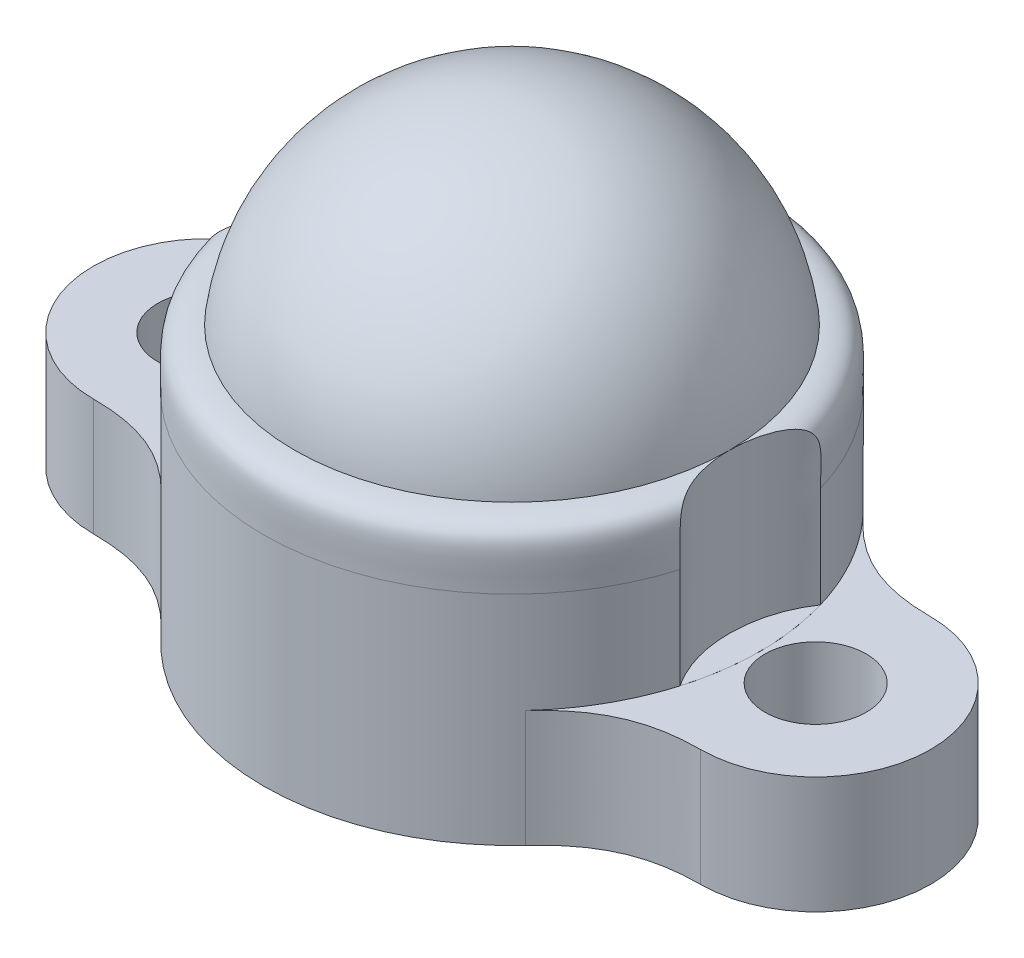
from build123d import *

# Parameters (mm, degrees)
BOSS_EXTRUDE1_START     = -2.54
BOSS_EXTRUDE1_OUTLINE_R = 1.1
BOSS_EXTRUDE1_DEPTH     = 2.54
SKETCH3_RX              = 2.33666154
SKETCH3_RY              = 1.874039112
CUT_EXTRUDE1_DEPTH      = 14.04273116


# Read off the part's stored shape, not the designer's step: Boss-Extrude1
with BuildPart() as part:
    # Sketch1 → Revolve3 (revolve)
    with BuildSketch(Plane.XY, mode=Mode.PRIVATE) as revolve3_sk:
        with BuildLine():
            Line((0, -5.3975), (0, 4.7625))
            ThreePointArc((0, 4.7625), (-3.152553538, 3.569707612), (-4.725960888, 0.58881231))
            add(Edge.make_bspline(
                [(-4.725960888, 0.58881231), (-5.528679385, 0.558813228), (-5.399616231, 0.190451496), (-5.399616231, -0.666596714)],
                knots=[0, 0, 0, 0, 1, 1, 1, 1], degree=3))
            Line((-5.399616231, -0.666596714), (-5.399616231, -5.3975))
            Line((-5.399616231, -5.3975), (0, -5.3975))
        make_face()
    revolve(revolve3_sk.sketch.rotate(Axis((0, 8.574910523, 0), (0, -1, 0)), 180), axis=Axis((0, 8.574910523, 0), (0, -1, 0)))

    # Sketch3 → Cut-Extrude1 (cut, through all)
    with BuildSketch(Plane(origin=(0, -2.8575, 0), x_dir=(1, 0, 0), z_dir=(0, 1, 0))):
        with Locations(Location((-6.6, 0), (0, 0, 90))):
            Ellipse(SKETCH3_RX, SKETCH3_RY)
        with Locations(Location((6.6, 0), (0, 0, 90))):
            Ellipse(SKETCH3_RX, SKETCH3_RY)
    extrude(amount=CUT_EXTRUDE1_DEPTH, mode=Mode.SUBTRACT)


with BuildPart() as body_2:
    # Boss-Extrude1 outline → Boss-Extrude1 (new body)
    # profile 1 of 2: a face of its own
    with BuildSketch(Plane.XZ.offset(5.3975).offset(BOSS_EXTRUDE1_START)):
        with BuildLine():
            add(Edge.make_bspline(
                [(6.6, -2.5), (5.362311666, -2.5), (4.636385799, -2.941104214), (3.959842535, -3.670899419)],
                knots=[0, 0, 0, 0, 1, 1, 1, 1], degree=3))
            ThreePointArc((6.6, -2.5), (9.1, 0), (6.6, 2.5))
            add(Edge.make_bspline(
                [(6.6, 2.5), (5.362311666, 2.5), (4.636385799, 2.941104214), (3.959842535, 3.670899419)],
                knots=[0, 0, 0, 0, 1, 1, 1, 1], degree=3))
            ThreePointArc((3.959842535, 3.670899419), (5.399616231, 0), (3.959842535, -3.670899419))
        make_face()
        with Locations((6.6, 0)):
            Circle(BOSS_EXTRUDE1_OUTLINE_R, mode=Mode.SUBTRACT)
    # profile 2 of 2: a face of its own
    with BuildSketch(Plane.XZ.offset(5.3975).offset(BOSS_EXTRUDE1_START)):
        with BuildLine():
            ThreePointArc((-6.6, 2.5), (-9.1, 0), (-6.6, -2.5))
            add(Edge.make_bspline(
                [(-6.6, -2.5), (-5.362311666, -2.5), (-4.636385799, -2.941104214), (-3.959842535, -3.670899419)],
                knots=[0, 0, 0, 0, 1, 1, 1, 1], degree=3))
            ThreePointArc((-3.959842535, -3.670899419), (-5.399616231, 0), (-3.959842535, 3.670899419))
            add(Edge.make_bspline(
                [(-6.6, 2.5), (-5.362311666, 2.5), (-4.636385799, 2.941104214), (-3.959842535, 3.670899419)],
                knots=[0, 0, 0, 0, 1, 1, 1, 1], degree=3))
        make_face()
        with Locations((-6.6, 0)):
            Circle(BOSS_EXTRUDE1_OUTLINE_R, mode=Mode.SUBTRACT)
    extrude(amount=BOSS_EXTRUDE1_DEPTH)


solid = Compound([part.part, body_2.part])
